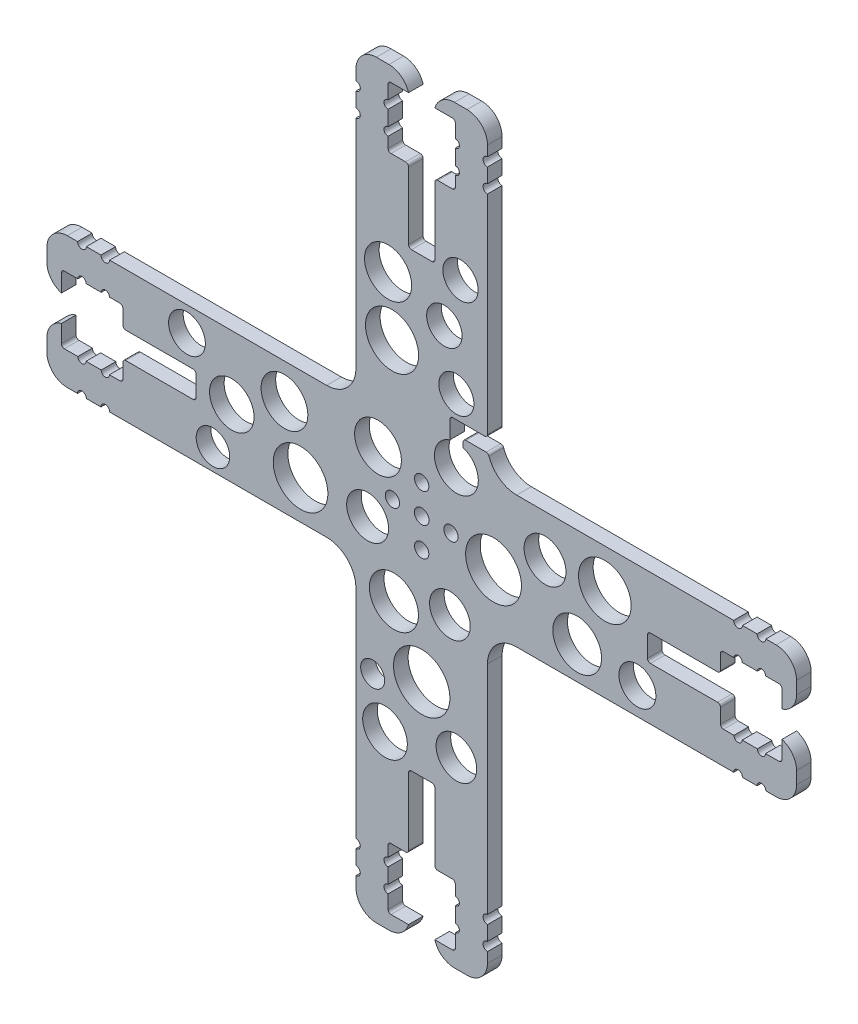
from build123d import *

# Parameters (mm, degrees)
ESQUISSE1_R             = 2.5
ESQUISSE1_R_2           = 6.290378139
ESQUISSE1_R_3           = 7.618744883
ESQUISSE1_R_4           = 9.342884094
ESQUISSE1_R_5           = 8
ESQUISSE1_R_6           = 5.733985396
ESQUISSE1_R_7           = 7.168610424
ESQUISSE1_R_8           = 9.550978203
ESQUISSE1_R_9           = 7.5
ESQUISSE1_R_10          = 9.082726935
ESQUISSE1_R_11          = 6
ESQUISSE1_R_12          = 7.167750482
ESQUISSE1_R_13          = 9.647142891
ESQUISSE1_R_14          = 4.114545692
ESQUISSE1_R_15          = 6.948511996
ESQUISSE1_R_16          = 7.63639155
ESQUISSE1_R_17          = 6.963077324
ESQUISSE1_R_18          = 8.386224211
ESQUISSE1_R_19          = 8.327924915
ESQUISSE1_R_20          = 9
ESQUISSE1_R_21          = 6.032963566
ESQUISSE1_R_22          = 8.061490044
ESQUISSE1_R_23          = 6.061600086
ESQUISSE1_R_24          = 6.327570879
ESQUISSE1_R_25          = 2.440410915
BOSS_EXTRU_1_DEPTH      = 5
CONG_1_R                = 7
CONG_2_R                = 10
CONG_3_R                = 1
ENL_V_MAT_EXTRU_1_DEPTH = 5
ENL_V_MAT_EXTRU_2_DEPTH = 10
CONG_4_R                = 1


with BuildPart() as part:
    # Esquisse1 → Boss.-Extru.1 (new body)
    with BuildSketch(Plane.XY):
        Polygon((-22.5, 22.5), (-22.5, 128.208152802), (-4.5, 128.208152802), (-4.5, 123.208152802), (-11.5, 123.208152802), (-11.5, 102.208152802), (-4.5, 102.208152802), (-4.5, 77.208152802), (4.5, 77.208152802), (4.5, 102.208152802), (11.5, 102.208152802), (11.5, 123.208152802), (4.5, 123.208152802), (4.5, 128.208152802), (22.5, 128.208152802), (22.5, 22.5), (128.208152802, 22.5), (128.208152802, 4.5), (123.208152802, 4.5), (123.208152802, 11.5), (102.208152802, 11.5), (102.208152802, 4.5), (77.208152802, 4.5), (77.208152802, -4.5), (102.208152802, -4.5), (102.208152802, -11.5), (123.208152802, -11.5), (123.208152802, -4.5), (128.208152802, -4.5), (128.208152802, -22.5), (22.5, -22.5), (22.5, -128.208152802), (4.5, -128.208152802), (4.5, -123.208152802), (11.5, -123.208152802), (11.5, -102.208152802), (4.5, -102.208152802), (4.5, -77.208152802), (-4.5, -77.208152802), (-4.5, -102.208152802), (-11.5, -102.208152802), (-11.5, -123.208152802), (-4.5, -123.208152802), (-4.5, -128.208152802), (-22.5, -128.208152802), (-22.5, -22.5), (-128.208152802, -22.5), (-128.208152802, -4.5), (-123.208152802, -4.5), (-123.208152802, -11.5), (-102.208152802, -11.5), (-102.208152802, -4.5), (-77.208152802, -4.5), (-77.208152802, 4.5), (-102.208152802, 4.5), (-102.208152802, 11.5), (-123.208152802, 11.5), (-123.208152802, 4.5), (-128.208152802, 4.5), (-128.208152802, 22.5), align=None)
        Circle(ESQUISSE1_R, mode=Mode.SUBTRACT)
        with Locations((-80.282411018, 14.110251439)):
            Circle(ESQUISSE1_R_2, mode=Mode.SUBTRACT)
        with Locations((-64.949362121, 0.629584275)):
            Circle(ESQUISSE1_R_3, mode=Mode.SUBTRACT)
        with Locations((-41.430541152, -9.342884094)):
            Circle(ESQUISSE1_R_4, mode=Mode.SUBTRACT)
        with Locations((-46.944423754, 10.513709378)):
            Circle(ESQUISSE1_R_5, mode=Mode.SUBTRACT)
        with Locations((-71.395066993, -15.225367939)):
            Circle(ESQUISSE1_R_6, mode=Mode.SUBTRACT)
        with Locations((42.187874431, 8.059360788)):
            Circle(ESQUISSE1_R_7, mode=Mode.SUBTRACT)
        with Locations((24.569766698, -3.608898698)):
            Circle(ESQUISSE1_R_8, mode=Mode.SUBTRACT)
        with Locations((11.862667495, 20.250700486)):
            Circle(ESQUISSE1_R_9, mode=Mode.SUBTRACT)
        with Locations((-14.944104017, 12.98285728)):
            Circle(ESQUISSE1_R_5, mode=Mode.SUBTRACT)
        with Locations((-10.143293911, 47.063988669)):
            Circle(ESQUISSE1_R_10, mode=Mode.SUBTRACT)
        with Locations((11.862667495, 42.14894077)):
            Circle(ESQUISSE1_R_11, mode=Mode.SUBTRACT)
        with Locations((-18.5, -9.342884094)):
            Circle(ESQUISSE1_R_12, mode=Mode.SUBTRACT)
        with Locations((0, -49.063569244)):
            Circle(ESQUISSE1_R_13, mode=Mode.SUBTRACT)
        with Locations((-16.764691508, -55.059756167)):
            Circle(ESQUISSE1_R_14, mode=Mode.SUBTRACT)
        with Locations((11.862667495, -65.512685953)):
            Circle(ESQUISSE1_R_15, mode=Mode.SUBTRACT)
        with Locations((-12.542488913, -70.059759302)):
            Circle(ESQUISSE1_R_16, mode=Mode.SUBTRACT)
        with Locations((9.647142891, -24.376295094)):
            Circle(ESQUISSE1_R_17, mode=Mode.SUBTRACT)
        with Locations((-9.504865065, -29.928488599)):
            Circle(ESQUISSE1_R_18, mode=Mode.SUBTRACT)
        with Locations((53.183428634, -11.306432287)):
            Circle(ESQUISSE1_R_19, mode=Mode.SUBTRACT)
        with Locations((62.644662275, 9.24529367)):
            Circle(ESQUISSE1_R_20, mode=Mode.SUBTRACT)
        with Locations((13.271791627, 76.57620739)):
            Circle(ESQUISSE1_R_21, mode=Mode.SUBTRACT)
        with Locations((-11.5, 66.604890937)):
            Circle(ESQUISSE1_R_22, mode=Mode.SUBTRACT)
        with Locations((7.759849222, 60.302853622)):
            Circle(ESQUISSE1_R_23, mode=Mode.SUBTRACT)
        with Locations((73.769463808, -13.24450165)):
            Circle(ESQUISSE1_R_24, mode=Mode.SUBTRACT)
        with Locations((10, 0)):
            Circle(ESQUISSE1_R_25, mode=Mode.SUBTRACT)
        with Locations((0, -10)):
            Circle(ESQUISSE1_R_25, mode=Mode.SUBTRACT)
        with Locations((-10, 0)):
            Circle(ESQUISSE1_R_25, mode=Mode.SUBTRACT)
        with Locations((0, 10)):
            Circle(ESQUISSE1_R_25, mode=Mode.SUBTRACT)
    extrude(amount=BOSS_EXTRU_1_DEPTH)

    # Congé1
    # the kernel refuses this fillet: 7 mm, written as the material it takes off along each edge
    with BuildSketch(Plane(origin=(128.208152802, 4.5, -16.770509831), x_dir=(0, 1, 0), z_dir=(0, 0, 1)), Plane(origin=(4.5, -128.208152802, -16.770509831), x_dir=(1, 0, 0), z_dir=(0, 0, 1)), Plane(origin=(-128.208152802, -4.5, -16.770509831), x_dir=(0, -1, 0), z_dir=(0, 0, 1)), Plane(origin=(-4.5, 128.208152802, -16.770509831), x_dir=(-1, 0, 0), z_dir=(0, 0, 1))) as cong_1_piece_1:
        with BuildLine():
            CenterArc((6.708203932, 7), CONG_1_R, 196.601549599, 73.398450401)
            Line((0, 5), (-0.134164079, 4.96))
            ThreePointArc((-0.134164079, 4.96), (-0.14, 2.5), (-0.14, 0))
            Line((-0.14, 0), (0, -0.14))
            Line((0, -0.14), (6.708203932, -0.14))
            Line((6.708203932, -0.14), (6.708203932, 0))
        make_face()
    extrude(amount=38.541019662, mode=Mode.SUBTRACT)
    with BuildSketch(Plane(origin=(128.208152802, -4.5, -16.770509831), x_dir=(-1, 0, 0), z_dir=(0, 0, 1)), Plane(origin=(-4.5, -128.208152802, -16.770509831), x_dir=(0, 1, 0), z_dir=(0, 0, 1)), Plane(origin=(-128.208152802, 4.5, -16.770509831), x_dir=(1, 0, 0), z_dir=(0, 0, 1)), Plane(origin=(4.5, 128.208152802, -16.770509831), x_dir=(0, -1, 0), z_dir=(0, 0, 1))) as cong_1_piece_2:
        with BuildLine():
            CenterArc((7, 6.708203932), CONG_1_R, 180, 73.398450401)
            Line((0, 6.708203932), (-0.14, 6.708203932))
            Line((-0.14, 6.708203932), (-0.14, 0))
            Line((-0.14, 0), (0, -0.14))
            ThreePointArc((0, -0.14), (2.5, -0.14), (4.96, -0.134164079))
            Line((4.96, -0.134164079), (5, 0))
        make_face()
    extrude(amount=38.541019662, mode=Mode.SUBTRACT)
    with BuildSketch(Plane(origin=(22.5, 128.208152802, -17.5), x_dir=(-1, 0, 0), z_dir=(0, 0, 1)), Plane(origin=(-22.5, 128.208152802, -17.5), x_dir=(0, -1, 0), z_dir=(0, 0, 1)), Plane(origin=(-128.208152802, 22.5, -17.5), x_dir=(0, -1, 0), z_dir=(0, 0, 1)), Plane(origin=(-128.208152802, -22.5, -17.5), x_dir=(1, 0, 0), z_dir=(0, 0, 1)), Plane(origin=(-22.5, -128.208152802, -17.5), x_dir=(1, 0, 0), z_dir=(0, 0, 1)), Plane(origin=(22.5, -128.208152802, -17.5), x_dir=(0, 1, 0), z_dir=(0, 0, 1)), Plane(origin=(128.208152802, -22.5, -17.5), x_dir=(0, 1, 0), z_dir=(0, 0, 1)), Plane(origin=(128.208152802, 22.5, -17.5), x_dir=(-1, 0, 0), z_dir=(0, 0, 1))) as cong_1_piece_3:
        with BuildLine():
            CenterArc((CONG_1_R, CONG_1_R), CONG_1_R, 180, 90)
            Line((0, CONG_1_R), (-CONG_1_R * 0.02, CONG_1_R))
            Line((-CONG_1_R * 0.02, CONG_1_R), (-CONG_1_R * 0.02, -CONG_1_R * 0.02))
            Line((-CONG_1_R * 0.02, -CONG_1_R * 0.02), (CONG_1_R, -CONG_1_R * 0.02))
            Line((CONG_1_R, -CONG_1_R * 0.02), (CONG_1_R, 0))
        make_face()
    extrude(amount=40, mode=Mode.SUBTRACT)

    # Congé2
    cong_2_edges = [part.edges().sort_by_distance(p)[0] for p in [
        (22.5, -22.5, 2.5),
        (-22.5, -22.5, 2.5),
        (-22.5, 22.5, 2.5),
        (22.5, 22.5, 2.5),
    ]]
    fillet(cong_2_edges, radius=CONG_2_R)

    # Congé3
    cong_3_edges = [part.edges().sort_by_distance(p)[0] for p in [
        (102.208152802, -11.5, 2.5),
        (123.208152802, -11.5, 2.5),
        (11.5, -123.208152802, 2.5),
        (11.5, -102.208152802, 2.5),
        (4.5, -102.208152802, 2.5),
        (4.5, -77.208152802, 2.5),
        (-4.5, -77.208152802, 2.5),
        (-4.5, -102.208152802, 2.5),
        (-11.5, -102.208152802, 2.5),
        (-11.5, -123.208152802, 2.5),
        (-123.208152802, -11.5, 2.5),
        (-102.208152802, -11.5, 2.5),
        (-102.208152802, -4.5, 2.5),
        (-77.208152802, -4.5, 2.5),
        (-77.208152802, 4.5, 2.5),
        (-102.208152802, 4.5, 2.5),
        (-102.208152802, 11.5, 2.5),
        (-123.208152802, 11.5, 2.5),
        (-11.5, 123.208152802, 2.5),
        (-11.5, 102.208152802, 2.5),
        (-4.5, 102.208152802, 2.5),
        (-4.5, 77.208152802, 2.5),
        (4.5, 77.208152802, 2.5),
        (4.5, 102.208152802, 2.5),
        (11.5, 102.208152802, 2.5),
        (11.5, 123.208152802, 2.5),
        (123.208152802, 11.5, 2.5),
        (102.208152802, 11.5, 2.5),
        (102.208152802, 4.5, 2.5),
        (77.208152802, 4.5, 2.5),
        (77.208152802, -4.5, 2.5),
        (102.208152802, -4.5, 2.5),
    ]]
    fillet(cong_3_edges, radius=CONG_3_R)

    # Esquisse2 → Enlèv. mat.-Extru.1 (cut)
    with BuildSketch(Plane(origin=(0, 0, 0), x_dir=(-1, 0, 0), z_dir=(0, 0, -1))):
        with BuildLine():
            Line((-117.708152802, 22.5), (-114.708152802, 22.5))
            ThreePointArc((-114.708152802, 22.5), (-116.208152802, 21), (-117.708152802, 22.5))
        make_face()
        with BuildLine():
            Line((-109.708152802, 22.5), (-106.708152802, 22.5))
            ThreePointArc((-106.708152802, 22.5), (-108.208152802, 21), (-109.708152802, 22.5))
        make_face()
        with BuildLine():
            Line((-117.708152802, -22.5), (-114.708152802, -22.5))
            ThreePointArc((-114.708152802, -22.5), (-116.208152802, -21), (-117.708152802, -22.5))
        make_face()
        with BuildLine():
            Line((-109.708152802, -22.5), (-106.708152802, -22.5))
            ThreePointArc((-106.708152802, -22.5), (-108.208152802, -21), (-109.708152802, -22.5))
        make_face()
        with BuildLine():
            Line((22.5, 117.708152802), (22.5, 114.708152802))
            ThreePointArc((22.5, 114.708152802), (21, 116.208152802), (22.5, 117.708152802))
        make_face()
        with BuildLine():
            Line((22.5, 109.708152802), (22.5, 106.708152802))
            ThreePointArc((22.5, 106.708152802), (21, 108.208152802), (22.5, 109.708152802))
        make_face()
        with BuildLine():
            Line((-22.5, 117.708152802), (-22.5, 114.708152802))
            ThreePointArc((-22.5, 114.708152802), (-21, 116.208152802), (-22.5, 117.708152802))
        make_face()
        with BuildLine():
            Line((-22.5, 109.708152802), (-22.5, 106.708152802))
            ThreePointArc((-22.5, 106.708152802), (-21, 108.208152802), (-22.5, 109.708152802))
        make_face()
        with BuildLine():
            Line((117.708152802, -22.5), (114.708152802, -22.5))
            ThreePointArc((114.708152802, -22.5), (116.208152802, -21), (117.708152802, -22.5))
        make_face()
        with BuildLine():
            Line((109.708152802, -22.5), (106.708152802, -22.5))
            ThreePointArc((106.708152802, -22.5), (108.208152802, -21), (109.708152802, -22.5))
        make_face()
        with BuildLine():
            Line((117.708152802, 22.5), (114.708152802, 22.5))
            ThreePointArc((114.708152802, 22.5), (116.208152802, 21), (117.708152802, 22.5))
        make_face()
        with BuildLine():
            Line((109.708152802, 22.5), (106.708152802, 22.5))
            ThreePointArc((106.708152802, 22.5), (108.208152802, 21), (109.708152802, 22.5))
        make_face()
        with BuildLine():
            Line((-22.5, -117.708152802), (-22.5, -114.708152802))
            ThreePointArc((-22.5, -114.708152802), (-21, -116.208152802), (-22.5, -117.708152802))
        make_face()
        with BuildLine():
            Line((-22.5, -109.708152802), (-22.5, -106.708152802))
            ThreePointArc((-22.5, -106.708152802), (-21, -108.208152802), (-22.5, -109.708152802))
        make_face()
        with BuildLine():
            Line((22.5, -117.708152802), (22.5, -114.708152802))
            ThreePointArc((22.5, -114.708152802), (21, -116.208152802), (22.5, -117.708152802))
        make_face()
        with BuildLine():
            Line((22.5, -109.708152802), (22.5, -106.708152802))
            ThreePointArc((22.5, -106.708152802), (21, -108.208152802), (22.5, -109.708152802))
        make_face()
        with BuildLine():
            Line((-114.808152802, 11.5), (-117.608152802, 11.5))
            ThreePointArc((-117.608152802, 11.5), (-116.208152802, 12.9), (-114.808152802, 11.5))
        make_face()
        with BuildLine():
            Line((-109.608152802, 11.5), (-106.808152802, 11.5))
            ThreePointArc((-106.808152802, 11.5), (-108.208152802, 12.9), (-109.608152802, 11.5))
        make_face()
        with BuildLine():
            Line((-109.608152802, -11.5), (-106.808152802, -11.5))
            ThreePointArc((-106.808152802, -11.5), (-108.208152802, -12.9), (-109.608152802, -11.5))
        make_face()
        with BuildLine():
            Line((-114.808152802, -11.5), (-117.608152802, -11.5))
            ThreePointArc((-117.608152802, -11.5), (-116.208152802, -12.9), (-114.808152802, -11.5))
        make_face()
        with BuildLine():
            Line((-11.5, 114.808152802), (-11.5, 117.608152802))
            ThreePointArc((-11.5, 117.608152802), (-12.9, 116.208152802), (-11.5, 114.808152802))
        make_face()
        with BuildLine():
            Line((-11.5, 109.608152802), (-11.5, 106.808152802))
            ThreePointArc((-11.5, 106.808152802), (-12.9, 108.208152802), (-11.5, 109.608152802))
        make_face()
        with BuildLine():
            Line((11.5, 114.808152802), (11.5, 117.608152802))
            ThreePointArc((11.5, 117.608152802), (12.9, 116.208152802), (11.5, 114.808152802))
        make_face()
        with BuildLine():
            Line((11.5, 109.608152802), (11.5, 106.808152802))
            ThreePointArc((11.5, 106.808152802), (12.9, 108.208152802), (11.5, 109.608152802))
        make_face()
        with BuildLine():
            Line((114.808152802, 11.5), (117.608152802, 11.5))
            ThreePointArc((117.608152802, 11.5), (116.208152802, 12.9), (114.808152802, 11.5))
        make_face()
        with BuildLine():
            Line((109.608152802, 11.5), (106.808152802, 11.5))
            ThreePointArc((106.808152802, 11.5), (108.208152802, 12.9), (109.608152802, 11.5))
        make_face()
        with BuildLine():
            Line((114.808152802, -11.5), (117.608152802, -11.5))
            ThreePointArc((117.608152802, -11.5), (116.208152802, -12.9), (114.808152802, -11.5))
        make_face()
        with BuildLine():
            Line((109.608152802, -11.5), (106.808152802, -11.5))
            ThreePointArc((106.808152802, -11.5), (108.208152802, -12.9), (109.608152802, -11.5))
        make_face()
        with BuildLine():
            Line((11.5, -114.808152802), (11.5, -117.608152802))
            ThreePointArc((11.5, -117.608152802), (12.9, -116.208152802), (11.5, -114.808152802))
        make_face()
        with BuildLine():
            Line((11.5, -109.608152802), (11.5, -106.808152802))
            ThreePointArc((11.5, -106.808152802), (12.9, -108.208152802), (11.5, -109.608152802))
        make_face()
        with BuildLine():
            Line((-11.5, -114.808152802), (-11.5, -117.608152802))
            ThreePointArc((-11.5, -117.608152802), (-12.9, -116.208152802), (-11.5, -114.808152802))
        make_face()
        with BuildLine():
            Line((-11.5, -109.608152802), (-11.5, -106.808152802))
            ThreePointArc((-11.5, -106.808152802), (-12.9, -108.208152802), (-11.5, -109.608152802))
        make_face()
    extrude(amount=-ENL_V_MAT_EXTRU_1_DEPTH, mode=Mode.SUBTRACT)

    # Esquisse3 → Enlèv. mat.-Extru.2 (cut)
    with BuildSketch(Plane(origin=(0, 0, 0), x_dir=(-1, 0, 0), z_dir=(0, 0, -1))):
        Polygon((-23.061872632, 34.510165549), (-9.612667495, 34.510165549), (-9.612667495, 27.405244496), (-14.112667495, 27.405244496), (-14.112667495, 30.010165549), (-23.061872632, 30.010165549), align=None)
    extrude(amount=-ENL_V_MAT_EXTRU_2_DEPTH, mode=Mode.SUBTRACT)

    # Congé4
    cong_4_edges = [part.edges().sort_by_distance(p)[0] for p in [
        (22.814922592, 30.010165549, 2.5),
        (22.5, 34.510165549, 2.5),
        (9.612667495, 34.510165549, 2.5),
        (14.112667495, 30.010165549, 2.5),
    ]]
    fillet(cong_4_edges, radius=CONG_4_R)


solid = part.part
